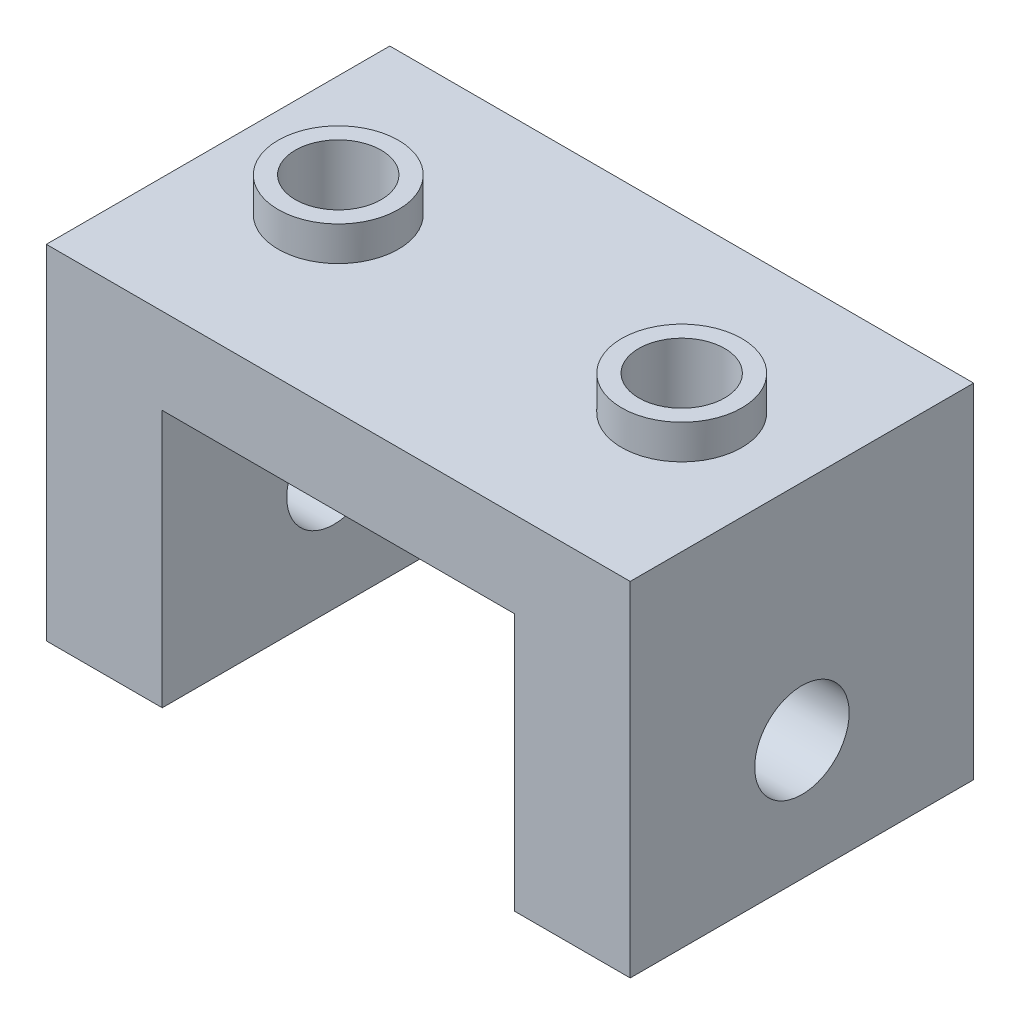
from build123d import *

# Parameters (mm, degrees)
SKETCH1_W            = 34
SKETCH1_H            = 20
BOSS_EXTRUDE1_DEPTH  = 5
SKETCH2_R            = 3.5
BOSS_EXTRUDE2_DEPTH  = 2
SKETCH3_R            = 2.5
CUT_EXTRUDE1_DEPTH   = 4.5
SKETCH4_W            = 6.75
SKETCH4_H            = 20
BOSS_EXTRUDE3_DEPTH  = 15
M5_CLEARANCE_HOLE1_D = 5.5


with BuildPart() as part:
    # Sketch1 → Boss-Extrude1 (new body)
    with BuildSketch(Plane(origin=(0, 0, 0), x_dir=(1, 0, 0), z_dir=(0, 1, 0))):
        Rectangle(SKETCH1_W, SKETCH1_H)
    extrude(amount=BOSS_EXTRUDE1_DEPTH)

    # Sketch2 → Boss-Extrude2 (add)
    with BuildSketch(Plane(origin=(0, 5, 0), x_dir=(1, 0, 0), z_dir=(0, 1, 0))):
        with Locations((-10, 0)):
            Circle(SKETCH2_R)
        with Locations((10, 0)):
            Circle(SKETCH2_R)
    extrude(amount=BOSS_EXTRUDE2_DEPTH)

    # Sketch3 → Cut-Extrude1 (cut)
    with BuildSketch(Plane(origin=(0, 7, 0), x_dir=(1, 0, 0), z_dir=(0, 1, 0))):
        with Locations((-10, 0)):
            Circle(SKETCH3_R)
        with Locations((10, 0)):
            Circle(SKETCH3_R)
    extrude(amount=-CUT_EXTRUDE1_DEPTH, mode=Mode.SUBTRACT)

    # Sketch4 → Boss-Extrude3 (add)
    with BuildSketch(Plane.XZ):
        with Locations((13.625, 0)):
            Rectangle(SKETCH4_W, SKETCH4_H)
        with Locations((-13.625, 0)):
            Rectangle(SKETCH4_W, SKETCH4_H)
    extrude(amount=BOSS_EXTRUDE3_DEPTH)

    # M5 Clearance Hole1 (through all)
    with Locations(Plane(origin=(17, -8, 0), x_dir=(0, 0, 1), z_dir=(1, 0, 0))):
        with Locations((0, 0)):
            Hole(M5_CLEARANCE_HOLE1_D / 2)


solid = part.part
